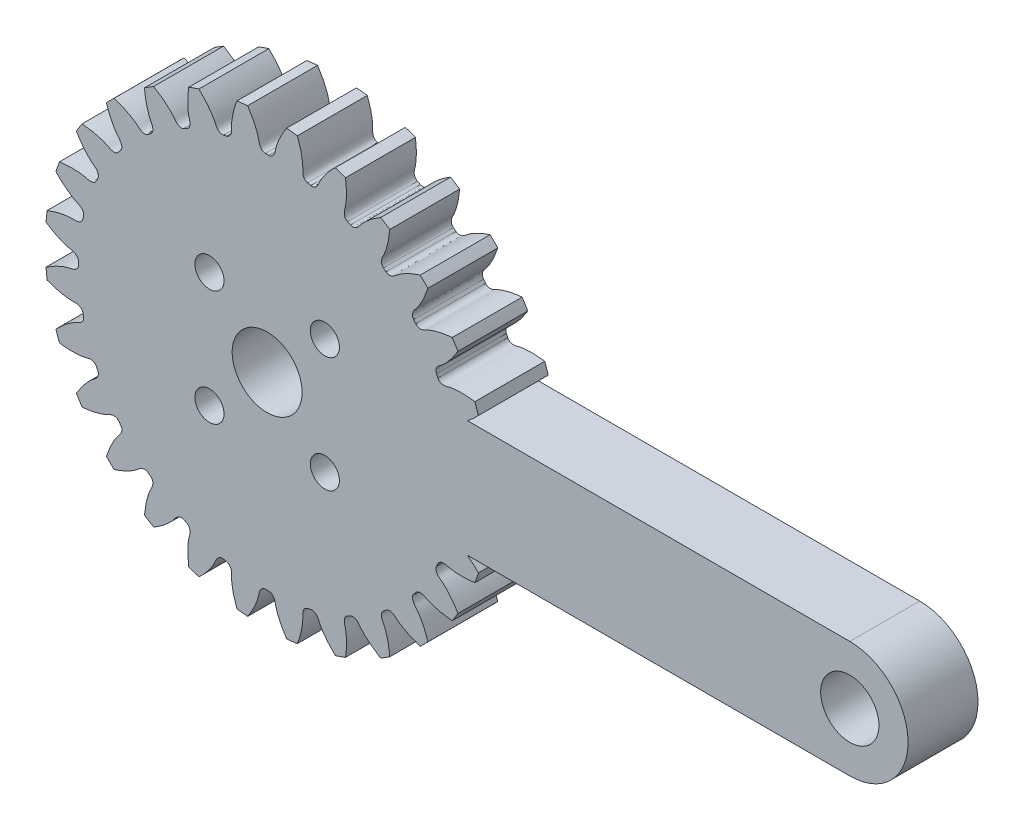
from build123d import *

# Parameters (mm, degrees)
GEAR_BASESKETCH_R                            = 19.05
F_20_0_DIAMETRAL_PITCH_35_5600MM_P_D_DEPTH   = 3
TOOTH_CUT_COARSE_PITCH_INVOLUTE_20_DEG_DEPTH = 28.107286843
TOOTH_PATTERN_28_28_COUNT                    = 28
SKETCH3_R                                    = 5
CUT_EXTRUDE2_DEPTH                           = 2
SKETCH4_R                                    = 3
CUT_EXTRUDE3_DEPTH                           = 28.499456869
SKETCH5_R                                    = 3
SKETCH5_R_2                                  = 2.5
BOSS_EXTRUDE2_DEPTH                          = 3
PATTERN_CIRCULAR_1_COUNT                     = 4


with BuildPart() as part:
    # Gear-BaseSketch → 20.0 Diametral Pitch, 35.5600mm P.D. (new, symmetric)
    with BuildSketch(Plane.XY):
        Circle(GEAR_BASESKETCH_R)
    extrude(amount=F_20_0_DIAMETRAL_PITCH_35_5600MM_P_D_DEPTH, both=True)

    # Tooth-Sketch; Backlash: 0.0000mm → Tooth-Cut, Coarse Pitch Involute 20 deg (cut, symmetric)
    with BuildSketch(Plane.XY):
        with BuildLine():
            ThreePointArc((-1.732860738, 19.067899218), (0, 19.146477142), (1.732860738, 19.067899218))
            add(Edge.make_bspline(
                [(1.732860738, 19.067899218), (1.61014985, 18.888831579), (1.441546973, 18.623646255), (1.245278251, 18.271393794), (1.123856631, 18.033000831), (1.021172403, 17.811361587), (0.93579472, 17.607512606), (0.866237396, 17.422407091), (0.810982673, 17.25690983), (0.768428075, 17.111803735), (0.737063166, 16.987762216), (0.717162116, 16.895551937), (0.705804675, 16.831999236), (0.698127451, 16.790388696), (0.690134238, 16.75328891), (0.675753861, 16.693809757), (0.651523441, 16.613266425), (0.609927392, 16.513281316), (0.553426706, 16.415715612), (0.47229177, 16.319550632), (0.338256217, 16.222121346), (0.214033446, 16.192287545), (0.139222699, 16.191901472)],
                knots=[0, 0, 0, 0, 0.191018288, 0.276294309, 0.35474825, 0.426380109, 0.491189887, 0.549177584, 0.6003432, 0.644686735, 0.682208189, 0.712907564, 0.727668831, 0.739016053, 0.750138704, 0.761058269, 0.792860949, 0.824037898, 0.856152362, 0.891704777, 0.93402643, 1, 1, 1, 1], degree=3))
            ThreePointArc((0.139222699, 16.191901472), (0, 16.1925), (-0.139222699, 16.191901472))
            add(Edge.make_bspline(
                [(-1.732860738, 19.067899218), (-1.61014985, 18.888831579), (-1.441546973, 18.623646255), (-1.245278251, 18.271393794), (-1.123856631, 18.033000831), (-1.021172403, 17.811361587), (-0.93579472, 17.607512606), (-0.866237396, 17.422407091), (-0.810982673, 17.25690983), (-0.768428075, 17.111803735), (-0.737063166, 16.987762216), (-0.717162116, 16.895551937), (-0.705804675, 16.831999236), (-0.698127451, 16.790388696), (-0.690134238, 16.75328891), (-0.675753861, 16.693809757), (-0.651523441, 16.613266425), (-0.609927392, 16.513281316), (-0.553426706, 16.415715612), (-0.47229177, 16.319550632), (-0.338256217, 16.222121346), (-0.214033446, 16.192287545), (-0.139222699, 16.191901472)],
                knots=[0, 0, 0, 0, 0.191018288, 0.276294309, 0.35474825, 0.426380109, 0.491189887, 0.549177584, 0.6003432, 0.644686735, 0.682208189, 0.712907564, 0.727668831, 0.739016053, 0.750138704, 0.761058269, 0.792860949, 0.824037898, 0.856152362, 0.891704777, 0.93402643, 1, 1, 1, 1], degree=3))
        make_face()
    tooth_cut_coarse_pitch_involute_20_deg = extrude(amount=TOOTH_CUT_COARSE_PITCH_INVOLUTE_20_DEG_DEPTH, both=True, mode=Mode.SUBTRACT)

    # Tooth Pattern, 28 / 28: Tooth-Cut, Coarse Pitch Involute 20 deg ×28 about axis
    tooth_pattern_28_28_axis = Axis((0, 0, -8.692656723), (0, 0, 1))
    for i in range(1, TOOTH_PATTERN_28_28_COUNT):
        add(tooth_cut_coarse_pitch_involute_20_deg.rotate(tooth_pattern_28_28_axis, i * 360 / TOOTH_PATTERN_28_28_COUNT), mode=Mode.SUBTRACT)

    # Sketch3 → Cut-Extrude2 (cut)
    with BuildSketch(Plane.XY.offset(3)):
        Circle(SKETCH3_R)
    extrude(amount=-CUT_EXTRUDE2_DEPTH, mode=Mode.SUBTRACT)

    # Sketch4 → Cut-Extrude3 (cut, through all)
    with BuildSketch(Plane.XY.offset(3)):
        Circle(SKETCH4_R)
    extrude(amount=-CUT_EXTRUDE3_DEPTH, mode=Mode.SUBTRACT)

    # Sketch5 → Boss-Extrude2 (add, symmetric)
    with BuildSketch(Plane.XY):
        with BuildLine():
            Line((0, 5), (50, 5))
            ThreePointArc((50, 5), (55, 0), (50, -5))
            Line((50, -5), (0, -5))
            ThreePointArc((0, -5), (-5, 0), (0, 5))
        make_face()
        Circle(SKETCH5_R, mode=Mode.SUBTRACT)
        with Locations((50, 0)):
            Circle(SKETCH5_R_2, mode=Mode.SUBTRACT)
    extrude(amount=BOSS_EXTRUDE2_DEPTH, both=True)

    # 草图1 → M3 螺纹孔1 (revolve, cut)
    with BuildSketch(Plane(origin=(-4.949747468, -4.949747468, 3), x_dir=(0, -1, 0), z_dir=(1, 0, 0))):
        Polygon((0, 0), (0, 9.251075774), (1.25, 8.5), (1.25, 0), align=None)
    hole_wizard_m3_1 = revolve(axis=Axis((-4.949747468, -4.949747468, 9.35), (0, 0, -1)), mode=Mode.SUBTRACT)

    # 阵列(圆周)1: M3 螺纹孔1 ×4 about axis
    pattern_circular_1_axis = Axis((0, 0, -3), (0, 0, 1))
    for i in range(1, PATTERN_CIRCULAR_1_COUNT):
        add(hole_wizard_m3_1.rotate(pattern_circular_1_axis, i * 360 / PATTERN_CIRCULAR_1_COUNT), mode=Mode.SUBTRACT)


solid = part.part
